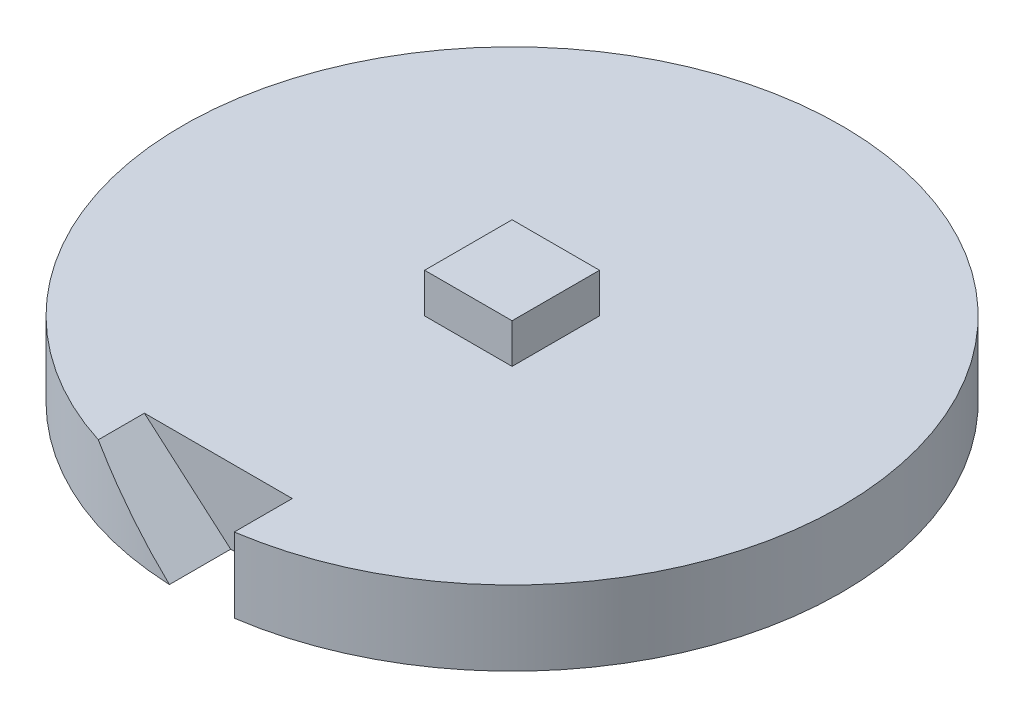
from build123d import *

# Parameters (mm, degrees)
SKETCH1_R           = 37.5
BOSS_EXTRUDE1_DEPTH = 8.5
SKETCH9_W           = 9.95
SKETCH9_H           = 9.95
BOSS_EXTRUDE2_DEPTH = 13
SKETCH2_R           = 5
BOSS_EXTRUDE3_DEPTH = 10
CUT_EXTRUDE5_DEPTH  = 10
CUT_EXTRUDE9_DEPTH  = 7


with BuildPart() as part:
    # Sketch1 → Boss-Extrude1 (new body)
    with BuildSketch(Plane(origin=(0, 0, 0), x_dir=(1, 0, 0), z_dir=(0, 1, 0))):
        Circle(SKETCH1_R)
    extrude(amount=BOSS_EXTRUDE1_DEPTH)

    # Sketch9 → Boss-Extrude2 (add)
    with BuildSketch(Plane(origin=(0, 0, 0), x_dir=(1, 0, 0), z_dir=(0, 1, 0))):
        Rectangle(SKETCH9_W, SKETCH9_H)
    extrude(amount=BOSS_EXTRUDE2_DEPTH)

    # Sketch2 → Boss-Extrude3 (add)
    with BuildSketch(Plane.XZ):
        Circle(SKETCH2_R)
    extrude(amount=BOSS_EXTRUDE3_DEPTH)

    # Sketch11 → Cut-Extrude5 (cut)
    with BuildSketch(Plane.XZ.offset(10)):
        with BuildLine():
            Line((0.018011531, -1.443232403), (0.565734089, -1.443232403))
            ThreePointArc((0.565734089, -1.443232403), (0.018011531, 1.556767597), (-0.529711026, -1.443232403))
            Line((-0.529711026, -1.443232403), (0.018011531, -1.443232403))
        make_face()
    extrude(amount=-CUT_EXTRUDE5_DEPTH, mode=Mode.SUBTRACT)

    # Sketch14 → Cut-Extrude9 (cut)
    with BuildSketch(Plane.XY.offset(37.5)):
        Polygon((-1.479409771, -0.034279728), (-11.335299807, 8.5), (5.487832291, 8.5), (5.487832291, 5.965720272), (5.487832291, -0.034279728), align=None)
    extrude(amount=-CUT_EXTRUDE9_DEPTH, mode=Mode.SUBTRACT)


solid = part.part
